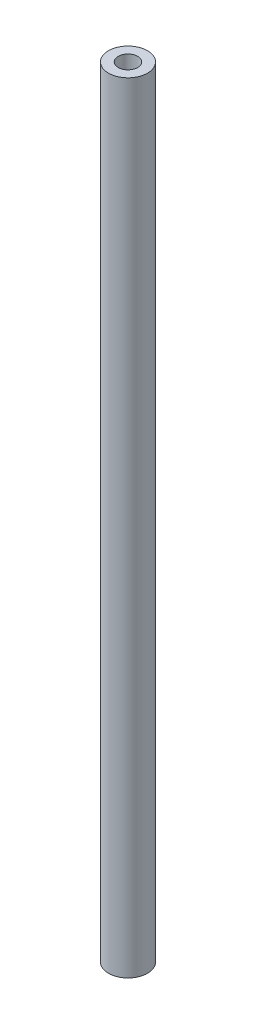
from build123d import *

# Parameters (mm, degrees)
SKETCH1_R           = 6.35
SKETCH1_R_2         = 3.175
BOSS_EXTRUDE1_DEPTH = 254


with BuildPart() as part:
    # Sketch1 → Boss-Extrude1 (new body)
    with BuildSketch(Plane(origin=(0, 0, 0), x_dir=(1, 0, 0), z_dir=(0, 1, 0))):
        Circle(SKETCH1_R)
        Circle(SKETCH1_R_2, mode=Mode.SUBTRACT)
    extrude(amount=BOSS_EXTRUDE1_DEPTH)


solid = part.part
